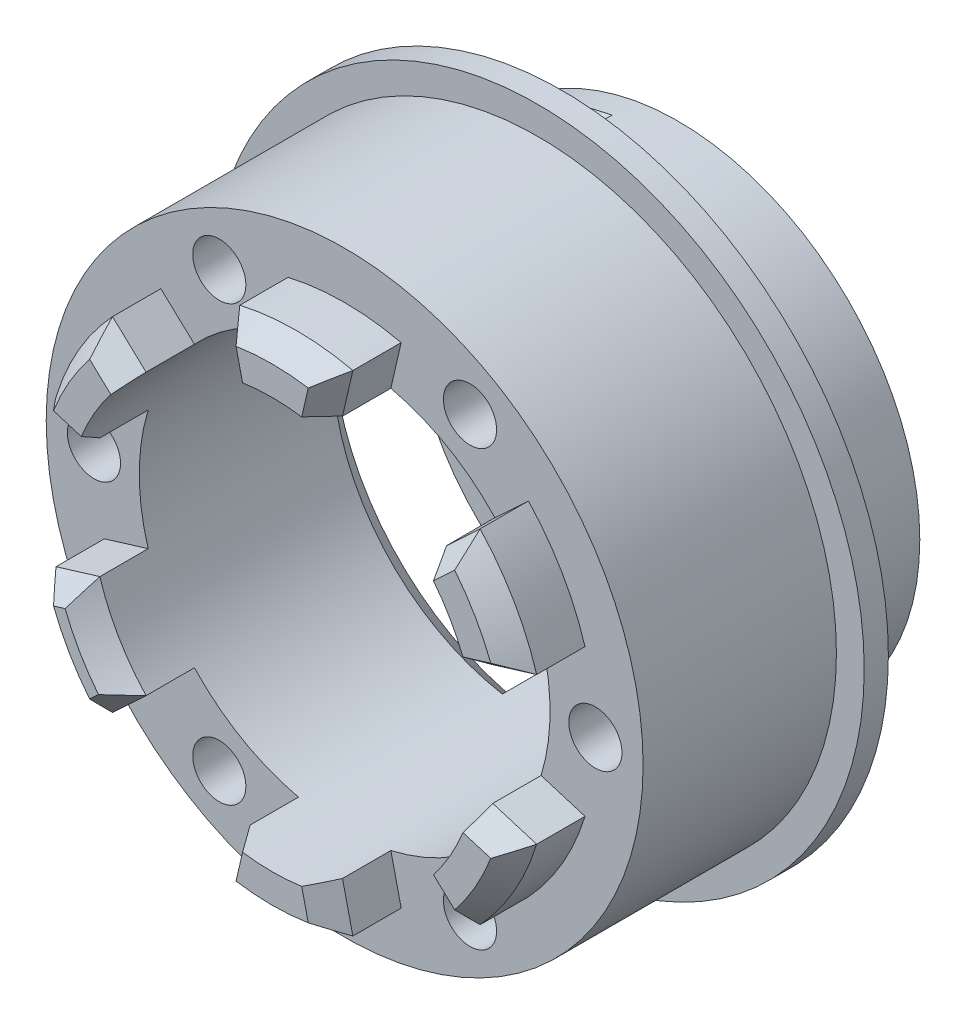
from build123d import *
from OCP.BRepFilletAPI import BRepFilletAPI_MakeChamfer
from build123d.topology import SkipClean

# Parameters (mm, degrees)
SKETCH_1_R          = 10
EXTRUDE_1_DEPTH     = 2
SKETCH_2_R          = 10
SKETCH_2_R_2        = 8.5
EXTRUDE_2_DEPTH     = 2.8
SKETCH_4_R          = 13.5
SKETCH_4_R_2        = 8.5
EXTRUDE_3_DEPTH     = 1
SKETCH_5_R          = 12.35
SKETCH_5_R_2        = 8.5
EXTRUDE_4_DEPTH     = 8
SKETCH_6_R          = 1.1
CUT_EXTRUDE_1_DEPTH = 8
SKETCH_7_R          = 3
SKETCH_7_R_2        = 1.15
CUT_EXTRUDE_2_DEPTH = 24.557164515
EXTRUDE_5_DEPTH     = 3
CHAMFER_1_SIZE      = 1
CHAMFER_1_SIZE2     = 0.700207538
CUT_EXTRUDE_START   = -2
SKETCH_11_R         = 1.15
CUT_EXTRUDE_3_DEPTH = 2.8
CHAMFER_2_SIZE      = 1


with BuildPart() as part:
    # 스케치1 → 보스-돌출1 (new body)
    with BuildSketch(Plane.XY):
        Circle(SKETCH_1_R)
    extrude(amount=EXTRUDE_1_DEPTH)

    # 스케치2 → 보스-돌출2 (add)
    with BuildSketch(Plane.XY.offset(2)):
        Circle(SKETCH_2_R)
        Circle(SKETCH_2_R_2, mode=Mode.SUBTRACT)
    extrude(amount=EXTRUDE_2_DEPTH)

    # 스케치4 → 보스-돌출3 (add)
    with BuildSketch(Plane.XY.offset(4.8)):
        Circle(SKETCH_4_R)
        Circle(SKETCH_4_R_2, mode=Mode.SUBTRACT)
    extrude(amount=EXTRUDE_3_DEPTH)

    # 스케치5 → 보스-돌출4 (add)
    with BuildSketch(Plane.XY.offset(5.8)):
        Circle(SKETCH_5_R)
        Circle(SKETCH_5_R_2, mode=Mode.SUBTRACT)
    extrude(amount=EXTRUDE_4_DEPTH)

    # 스케치6 → 컷-돌출1 (cut)
    with BuildSketch(Plane.XY.offset(13.8)):
        with Locations((10.375, 0)):
            Circle(SKETCH_6_R)
        with Locations((5.1875, -8.985013564)):
            Circle(SKETCH_6_R)
        with Locations((-5.1875, -8.985013564)):
            Circle(SKETCH_6_R)
        with Locations((-10.375, 0)):
            Circle(SKETCH_6_R)
        with Locations((-5.1875, 8.985013564)):
            Circle(SKETCH_6_R)
        with Locations((5.1875, 8.985013564)):
            Circle(SKETCH_6_R)
    extrude(amount=-CUT_EXTRUDE_1_DEPTH, mode=Mode.SUBTRACT)

    # 스케치7 → 컷-돌출2 (cut, through all)
    with BuildSketch(Plane(origin=(0, 0, 0), x_dir=(-1, 0, 0), z_dir=(0, 0, -1))):
        Circle(SKETCH_7_R)
        with Locations((-7, 0)):
            Circle(SKETCH_7_R_2)
        with Locations((7, 0)):
            Circle(SKETCH_7_R_2)
        with Locations((0, 7)):
            Circle(SKETCH_7_R_2)
        with Locations((0, -7)):
            Circle(SKETCH_7_R_2)
    extrude(amount=-CUT_EXTRUDE_2_DEPTH, mode=Mode.SUBTRACT)

    # 스케치10 → 보스-돌출5 (add)
    with SkipClean():  # the faces are left unmerged after this step: merging them gives an invalid solid
        with BuildSketch(Plane.XY.offset(13.8)):
            with BuildLine():
                Line((2.339490965, 10.133448674), (1.912083962, 8.282145551))
                ThreePointArc((1.912083962, 8.282145551), (0, 8.5), (-1.912083962, 8.282145551))
                Line((-1.912083962, 8.282145551), (-2.339490965, 10.133448674))
                ThreePointArc((-2.339490965, 10.133448674), (0, 10.4), (2.339490965, 10.133448674))
            make_face()
            with BuildLine():
                Line((7.606078497, 7.092782945), (6.216506464, 5.796986061))
                ThreePointArc((6.216506464, 5.796986061), (7.361215932, 4.25), (8.128590426, 2.48515949))
                Line((8.128590426, 2.48515949), (9.945569462, 3.040665729))
                ThreePointArc((9.945569462, 3.040665729), (9.006664199, 5.2), (7.606078497, 7.092782945))
            make_face()
            with BuildLine():
                Line((9.945569462, -3.040665729), (8.128590426, -2.48515949))
                ThreePointArc((8.128590426, -2.48515949), (7.361215932, -4.25), (6.216506464, -5.796986061))
                Line((6.216506464, -5.796986061), (7.606078497, -7.092782945))
                ThreePointArc((7.606078497, -7.092782945), (9.006664199, -5.2), (9.945569462, -3.040665729))
            make_face()
            with BuildLine():
                Line((2.339490965, -10.133448674), (1.912083962, -8.282145551))
                ThreePointArc((1.912083962, -8.282145551), (0, -8.5), (-1.912083962, -8.282145551))
                Line((-1.912083962, -8.282145551), (-2.339490965, -10.133448674))
                ThreePointArc((-2.339490965, -10.133448674), (0, -10.4), (2.339490965, -10.133448674))
            make_face()
            with BuildLine():
                Line((-7.606078497, -7.092782945), (-6.216506464, -5.796986061))
                ThreePointArc((-6.216506464, -5.796986061), (-7.361215932, -4.25), (-8.128590426, -2.48515949))
                Line((-8.128590426, -2.48515949), (-9.945569462, -3.040665729))
                ThreePointArc((-9.945569462, -3.040665729), (-9.006664199, -5.2), (-7.606078497, -7.092782945))
            make_face()
            with BuildLine():
                Line((-9.945569462, 3.040665729), (-8.128590426, 2.48515949))
                ThreePointArc((-8.128590426, 2.48515949), (-7.361215932, 4.25), (-6.216506464, 5.796986061))
                Line((-6.216506464, 5.796986061), (-7.606078497, 7.092782945))
                ThreePointArc((-7.606078497, 7.092782945), (-9.006664199, 5.2), (-9.945569462, 3.040665729))
            make_face()
        extrude(amount=EXTRUDE_5_DEPTH)

    # 모따기1: one chamfer whose edges measure the first distance from different faces: ONE call of the kernel's chamfer builder (chamfer() names one face for all edges)
    chamfer_1_edges_1 = [part.edges().sort_by_distance(p)[0] for p in [
        (-9.006664199, -5.2, 16.8),
    ]]
    chamfer_1_side_1 = [part.faces().sort_by_distance(p)[0] for p in [
        (-9.006664199, -5.2, 15.3),
    ]]
    chamfer_1_edges_2 = [part.edges().sort_by_distance(p)[0] for p in [
        (0, -10.4, 16.8),
    ]]
    chamfer_1_side_2 = [part.faces().sort_by_distance(p)[0] for p in [
        (0, -10.4, 15.3),
    ]]
    chamfer_1_edges_3 = [part.edges().sort_by_distance(p)[0] for p in [
        (9.006664199, -5.2, 16.8),
    ]]
    chamfer_1_side_3 = [part.faces().sort_by_distance(p)[0] for p in [
        (9.006664199, -5.2, 15.3),
    ]]
    chamfer_1_edges_4 = [part.edges().sort_by_distance(p)[0] for p in [
        (9.006664199, 5.2, 16.8),
    ]]
    chamfer_1_side_4 = [part.faces().sort_by_distance(p)[0] for p in [
        (9.006664199, 5.2, 15.3),
    ]]
    chamfer_1_edges_5 = [part.edges().sort_by_distance(p)[0] for p in [
        (0, 10.4, 16.8),
    ]]
    chamfer_1_side_5 = [part.faces().sort_by_distance(p)[0] for p in [
        (0, 10.4, 15.3),
    ]]
    chamfer_1_edges_6 = [part.edges().sort_by_distance(p)[0] for p in [
        (-9.006664199, 5.2, 16.8),
    ]]
    chamfer_1_side_6 = [part.faces().sort_by_distance(p)[0] for p in [
        (-9.006664199, 5.2, 15.3),
    ]]
    chamfer_1_edges_7 = [part.edges().sort_by_distance(p)[0] for p in [
        (-9.037079944, -2.76291261, 16.8),
    ]]
    chamfer_1_side_7 = [part.faces().sort_by_distance(p)[0] for p in [
        (-9.037079944, -2.76291261, 15.3),
    ]]
    chamfer_1_edges_8 = [part.edges().sort_by_distance(p)[0] for p in [
        (-7.361215932, -4.25, 16.8),
    ]]
    chamfer_1_side_8 = [part.faces().sort_by_distance(p)[0] for p in [
        (-7.361215932, -4.25, 15.3),
    ]]
    chamfer_1_edges_9 = [part.edges().sort_by_distance(p)[0] for p in [
        (-6.91129248, -6.444884503, 16.8),
    ]]
    chamfer_1_side_9 = [part.faces().sort_by_distance(p)[0] for p in [
        (-6.91129248, -6.444884503, 15.3),
    ]]
    chamfer_1_edges_10 = [part.edges().sort_by_distance(p)[0] for p in [
        (2.125787464, -9.207797112, 16.8),
    ]]
    chamfer_1_side_10 = [part.faces().sort_by_distance(p)[0] for p in [
        (2.125787464, -9.207797112, 15.3),
    ]]
    chamfer_1_edges_11 = [part.edges().sort_by_distance(p)[0] for p in [
        (-2.125787464, -9.207797112, 16.8),
    ]]
    chamfer_1_side_11 = [part.faces().sort_by_distance(p)[0] for p in [
        (-2.125787464, -9.207797112, 15.3),
    ]]
    chamfer_1_edges_12 = [part.edges().sort_by_distance(p)[0] for p in [
        (6.91129248, -6.444884503, 16.8),
    ]]
    chamfer_1_side_12 = [part.faces().sort_by_distance(p)[0] for p in [
        (6.91129248, -6.444884503, 15.3),
    ]]
    chamfer_1_edges_13 = [part.edges().sort_by_distance(p)[0] for p in [
        (9.037079944, -2.76291261, 16.8),
    ]]
    chamfer_1_side_13 = [part.faces().sort_by_distance(p)[0] for p in [
        (9.037079944, -2.76291261, 15.3),
    ]]
    chamfer_1_edges_14 = [part.edges().sort_by_distance(p)[0] for p in [
        (9.037079944, 2.76291261, 16.8),
    ]]
    chamfer_1_side_14 = [part.faces().sort_by_distance(p)[0] for p in [
        (9.037079944, 2.76291261, 15.3),
    ]]
    chamfer_1_edges_15 = [part.edges().sort_by_distance(p)[0] for p in [
        (6.91129248, 6.444884503, 16.8),
    ]]
    chamfer_1_side_15 = [part.faces().sort_by_distance(p)[0] for p in [
        (6.91129248, 6.444884503, 15.3),
    ]]
    chamfer_1_edges_16 = [part.edges().sort_by_distance(p)[0] for p in [
        (2.125787464, 9.207797112, 16.8),
    ]]
    chamfer_1_side_16 = [part.faces().sort_by_distance(p)[0] for p in [
        (2.125787464, 9.207797112, 15.3),
    ]]
    chamfer_1_edges_17 = [part.edges().sort_by_distance(p)[0] for p in [
        (-2.125787464, 9.207797112, 16.8),
    ]]
    chamfer_1_side_17 = [part.faces().sort_by_distance(p)[0] for p in [
        (-2.125787464, 9.207797112, 15.3),
    ]]
    chamfer_1_edges_18 = [part.edges().sort_by_distance(p)[0] for p in [
        (-9.037079944, 2.76291261, 16.8),
    ]]
    chamfer_1_side_18 = [part.faces().sort_by_distance(p)[0] for p in [
        (-9.037079944, 2.76291261, 15.3),
    ]]
    chamfer_1_edges_19 = [part.edges().sort_by_distance(p)[0] for p in [
        (-6.91129248, 6.444884503, 16.8),
    ]]
    chamfer_1_side_19 = [part.faces().sort_by_distance(p)[0] for p in [
        (-6.91129248, 6.444884503, 15.3),
    ]]
    chamfer_1 = BRepFilletAPI_MakeChamfer(part.part.solid().wrapped)
    for e in chamfer_1_edges_1:
        chamfer_1.Add(CHAMFER_1_SIZE, CHAMFER_1_SIZE2, e.wrapped, chamfer_1_side_1[0].wrapped)  # the first distance lies on this face
    for e in chamfer_1_edges_2:
        chamfer_1.Add(CHAMFER_1_SIZE, CHAMFER_1_SIZE2, e.wrapped, chamfer_1_side_2[0].wrapped)  # the first distance lies on this face
    for e in chamfer_1_edges_3:
        chamfer_1.Add(CHAMFER_1_SIZE, CHAMFER_1_SIZE2, e.wrapped, chamfer_1_side_3[0].wrapped)  # the first distance lies on this face
    for e in chamfer_1_edges_4:
        chamfer_1.Add(CHAMFER_1_SIZE, CHAMFER_1_SIZE2, e.wrapped, chamfer_1_side_4[0].wrapped)  # the first distance lies on this face
    for e in chamfer_1_edges_5:
        chamfer_1.Add(CHAMFER_1_SIZE, CHAMFER_1_SIZE2, e.wrapped, chamfer_1_side_5[0].wrapped)  # the first distance lies on this face
    for e in chamfer_1_edges_6:
        chamfer_1.Add(CHAMFER_1_SIZE, CHAMFER_1_SIZE2, e.wrapped, chamfer_1_side_6[0].wrapped)  # the first distance lies on this face
    for e in chamfer_1_edges_7:
        chamfer_1.Add(CHAMFER_1_SIZE, CHAMFER_1_SIZE2, e.wrapped, chamfer_1_side_7[0].wrapped)  # the first distance lies on this face
    for e in chamfer_1_edges_8:
        chamfer_1.Add(CHAMFER_1_SIZE, CHAMFER_1_SIZE2, e.wrapped, chamfer_1_side_8[0].wrapped)  # the first distance lies on this face
    for e in chamfer_1_edges_9:
        chamfer_1.Add(CHAMFER_1_SIZE, CHAMFER_1_SIZE2, e.wrapped, chamfer_1_side_9[0].wrapped)  # the first distance lies on this face
    for e in chamfer_1_edges_10:
        chamfer_1.Add(CHAMFER_1_SIZE, CHAMFER_1_SIZE2, e.wrapped, chamfer_1_side_10[0].wrapped)  # the first distance lies on this face
    for e in chamfer_1_edges_11:
        chamfer_1.Add(CHAMFER_1_SIZE, CHAMFER_1_SIZE2, e.wrapped, chamfer_1_side_11[0].wrapped)  # the first distance lies on this face
    for e in chamfer_1_edges_12:
        chamfer_1.Add(CHAMFER_1_SIZE, CHAMFER_1_SIZE2, e.wrapped, chamfer_1_side_12[0].wrapped)  # the first distance lies on this face
    for e in chamfer_1_edges_13:
        chamfer_1.Add(CHAMFER_1_SIZE, CHAMFER_1_SIZE2, e.wrapped, chamfer_1_side_13[0].wrapped)  # the first distance lies on this face
    for e in chamfer_1_edges_14:
        chamfer_1.Add(CHAMFER_1_SIZE, CHAMFER_1_SIZE2, e.wrapped, chamfer_1_side_14[0].wrapped)  # the first distance lies on this face
    for e in chamfer_1_edges_15:
        chamfer_1.Add(CHAMFER_1_SIZE, CHAMFER_1_SIZE2, e.wrapped, chamfer_1_side_15[0].wrapped)  # the first distance lies on this face
    for e in chamfer_1_edges_16:
        chamfer_1.Add(CHAMFER_1_SIZE, CHAMFER_1_SIZE2, e.wrapped, chamfer_1_side_16[0].wrapped)  # the first distance lies on this face
    for e in chamfer_1_edges_17:
        chamfer_1.Add(CHAMFER_1_SIZE, CHAMFER_1_SIZE2, e.wrapped, chamfer_1_side_17[0].wrapped)  # the first distance lies on this face
    for e in chamfer_1_edges_18:
        chamfer_1.Add(CHAMFER_1_SIZE, CHAMFER_1_SIZE2, e.wrapped, chamfer_1_side_18[0].wrapped)  # the first distance lies on this face
    for e in chamfer_1_edges_19:
        chamfer_1.Add(CHAMFER_1_SIZE, CHAMFER_1_SIZE2, e.wrapped, chamfer_1_side_19[0].wrapped)  # the first distance lies on this face
    add(Compound.cast(chamfer_1.Shape()), mode=Mode.REPLACE)

    # 스케치11 → 컷-돌출3 (cut)
    with BuildSketch(Plane(origin=(0, 0, 0), x_dir=(-1, 0, 0), z_dir=(0, 0, -1)).offset(CUT_EXTRUDE_START)):
        with BuildLine():
            Line((1.736481777, 9.84807753), (0.520944533, 2.954423259))
            ThreePointArc((0.520944533, 2.954423259), (3, 0), (0.520944533, -2.954423259))
            Line((0.520944533, -2.954423259), (1.736481777, -9.84807753))
            ThreePointArc((1.736481777, -9.84807753), (10, 0), (1.736481777, 9.84807753))
        make_face()
        with Locations((7, 0)):
            Circle(SKETCH_11_R, mode=Mode.SUBTRACT)
    extrude(amount=-CUT_EXTRUDE_3_DEPTH, mode=Mode.SUBTRACT)

    # 모따기2
    chamfer_2_edges = [part.edges().sort_by_distance(p)[0] for p in [
        (-8.5, 0, 4.8),
        (-10, 0, 2),
    ]]
    chamfer(chamfer_2_edges, length=CHAMFER_2_SIZE)


solid = part.part
